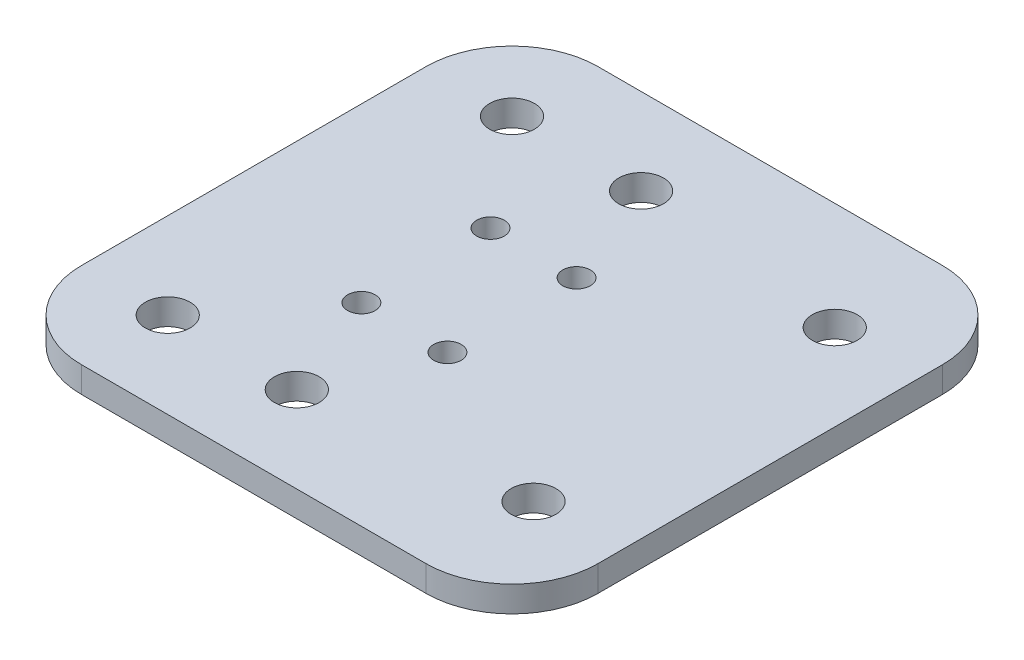
from build123d import *

# Parameters (mm, degrees)
EXTRUDE_1_DEPTH     = 3
SKETCH_2_R          = 1.6
SKETCH_2_R_2        = 2.6
CUT_EXTRUDE_1_DEPTH = 68.149087857
FILLET_1_R          = 10


with BuildPart() as part:
    # 草图1 → 凸台-拉伸1 (new body)
    with BuildSketch(Plane(origin=(0, 0, 0), x_dir=(1, 0, 0), z_dir=(0, 1, 0))):
        Polygon((0, -30), (0, 30), (21.715728753, 30), (60, 30), (60, -30), (21.715728753, -30), align=None)
    extrude(amount=EXTRUDE_1_DEPTH)

    # 草图2 → 切除-拉伸1 (cut, through all)
    with BuildSketch(Plane(origin=(0, 3, 0), x_dir=(1, 0, 0), z_dir=(0, 1, 0))):
        with Locations((20, 7.5)):
            Circle(SKETCH_2_R)
        with Locations((30, 7.5)):
            Circle(SKETCH_2_R)
        with Locations((30, -7.5)):
            Circle(SKETCH_2_R)
        with Locations((20, -7.5)):
            Circle(SKETCH_2_R)
        with Locations((10, 20)):
            Circle(SKETCH_2_R_2)
        with Locations((10, -20)):
            Circle(SKETCH_2_R_2)
        with Locations((25, 20)):
            Circle(SKETCH_2_R_2)
        with Locations((25, -20)):
            Circle(SKETCH_2_R_2)
        with Locations((50, 17.5)):
            Circle(SKETCH_2_R_2)
        with Locations((50, -17.5)):
            Circle(SKETCH_2_R_2)
    extrude(amount=-CUT_EXTRUDE_1_DEPTH, mode=Mode.SUBTRACT)

    # 圆角1
    fillet_1_edges = [part.edges().sort_by_distance(p)[0] for p in [
        (0, 1.5, 30),
        (0, 1.5, -30),
        (60, 1.5, 30),
        (60, 1.5, -30),
    ]]
    fillet(fillet_1_edges, radius=FILLET_1_R)


solid = part.part
